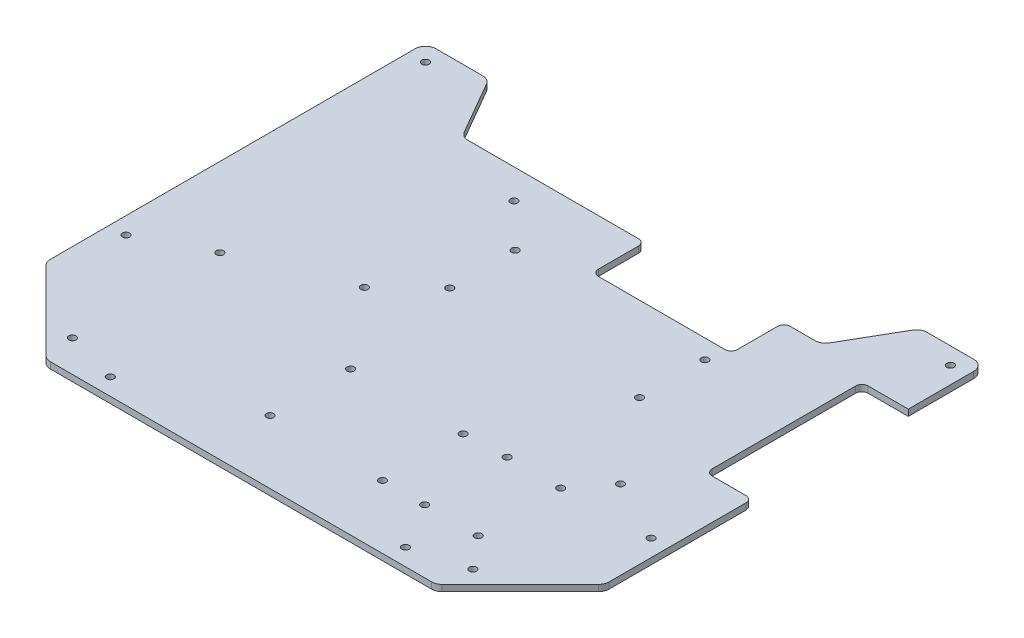
from build123d import *

# Parameters (mm, degrees)
BOSS_EXTRU_1_DEPTH           = 3
CONG_1_R                     = 5
ESQUISSE2_R                  = 1
ENL_V_MAT_EXTRU_1_DEPTH      = 3
D_GAGEMENT_M31_D             = 3.4
ESQUISSE5_W                  = 66
ESQUISSE5_H                  = 25
ESQUISSE5_W_2                = 22
ESQUISSE5_H_2                = 74
ENL_V_MAT_EXTRU_2_DEPTH      = 257.837010573
CONG_2_R                     = 3
ESQUISSE6_R                  = 1
ENL_V_MAT_EXTRU_3_DEPTH      = 257.837010573
D_GAGEMENT_M32_D             = 3.4
D_GAGEMENT_M32_DEPTH         = 10
D_GAGEMENT_M32_TIP           = 1.021463052
ESQUISSE9_R                  = 1
ENL_V_MAT_EXTRU_4_DEPTH      = 257.837010573
D_GAGEMENT_M33_D             = 3.4
D_GAGEMENT_M33_DEPTH         = 10
D_GAGEMENT_M33_TIP           = 1.021463052
ENL_V_MAT_EXTRU_5_DEPTH      = 257.837010573
ENL_V_MAT_EXTRU_5_DEPTH_BACK = 257.837010573
ESQUISSE12_R                 = 1
D_GAGEMENT_M34_D             = 3.4
D_GAGEMENT_M34_DEPTH         = 10
D_GAGEMENT_M34_TIP           = 1.021463052
D_GAGEMENT_M35_D             = 3.4
D_GAGEMENT_M35_DEPTH         = 10
D_GAGEMENT_M35_TIP           = 1.021463052


with BuildPart() as part:
    # Esquisse1 → Boss.-Extru.1 (new body)
    with BuildSketch(Plane(origin=(0, 0, 0), x_dir=(1, 0, 0), z_dir=(0, 1, 0))):
        Polygon((-92.5, 0), (92.5, 0), (132.5, 40), (132.5, 220), (102.5, 220), (85.179491924, 190), (-85.179491924, 190), (-102.5, 220), (-132.5, 220), (-132.5, 40), align=None)
    extrude(amount=BOSS_EXTRU_1_DEPTH)

    # Congé1
    cong_1_edges = [part.edges().sort_by_distance(p)[0] for p in [
        (92.5, 1.5, 0),
        (132.5, 1.5, -40),
        (132.5, 1.5, -220),
        (102.5, 1.5, -220),
        (85.179491924, 1.5, -190),
        (-85.179491924, 1.5, -190),
        (-102.5, 1.5, -220),
        (-132.5, 1.5, -220),
        (-92.5, 1.5, 0),
        (-132.5, 1.5, -40),
    ]]
    fillet(cong_1_edges, radius=CONG_1_R)

    # Esquisse2 → Enlèv. mat.-Extru.1 (cut)
    with BuildSketch(Plane(origin=(0, 3, 0), x_dir=(1, 0, 0), z_dir=(0, 1, 0))):
        with Locations((70, 8)):
            Circle(ESQUISSE2_R)
        with Locations((124.5, 70)):
            Circle(ESQUISSE2_R)
        with Locations((124.5, 212)):
            Circle(ESQUISSE2_R)
        with Locations((-124.5, 212)):
            Circle(ESQUISSE2_R)
        with Locations((-124.5, 70)):
            Circle(ESQUISSE2_R)
        with Locations((-70, 8)):
            Circle(ESQUISSE2_R)
    extrude(amount=-ENL_V_MAT_EXTRU_1_DEPTH, mode=Mode.SUBTRACT)

    # Dégagement M31 (through all)
    with Locations(Plane(origin=(0, 3, 0), x_dir=(1, 0, 0), z_dir=(0, 1, 0))):
        with Locations((70, 8), (-70, 8), (-124.5, 70), (-124.5, 212), (124.5, 212), (124.5, 70)):
            Hole(D_GAGEMENT_M31_D / 2)

    # Esquisse5 → Enlèv. mat.-Extru.2 (cut, through all)
    with BuildSketch(Plane(origin=(0, 3, 0), x_dir=(1, 0, 0), z_dir=(0, 1, 0))):
        with Locations((34.5, 177.5)):
            Rectangle(ESQUISSE5_W, ESQUISSE5_H)
        with Locations((121.5, 147)):
            Rectangle(ESQUISSE5_W_2, ESQUISSE5_H_2)
    extrude(amount=-ENL_V_MAT_EXTRU_2_DEPTH, mode=Mode.SUBTRACT)

    # Congé2
    cong_2_edges = [part.edges().sort_by_distance(p)[0] for p in [
        (132.5, 1.5, -110),
        (110.5, 1.5, -110),
        (110.5, 1.5, -184),
        (67.5, 1.5, -190),
        (67.5, 1.5, -165),
        (1.5, 1.5, -165),
        (1.5, 1.5, -190),
    ]]
    fillet(cong_2_edges, radius=CONG_2_R)

    # Esquisse6 → Enlèv. mat.-Extru.3 (cut, through all)
    with BuildSketch(Plane(origin=(0, 3, 0), x_dir=(1, 0, 0), z_dir=(0, 1, 0))):
        with Locations((64, 156)):
            Circle(ESQUISSE6_R)
        with Locations((-26, 156)):
            Circle(ESQUISSE6_R)
        with Locations((-46.5, 176)):
            Circle(ESQUISSE6_R)
        with Locations((64, 125)):
            Circle(ESQUISSE6_R)
        with Locations((-26, 125)):
            Circle(ESQUISSE6_R)
        with Locations((-46.5, 105)):
            Circle(ESQUISSE6_R)
    extrude(amount=-ENL_V_MAT_EXTRU_3_DEPTH, mode=Mode.SUBTRACT)

    # Dégagement M32
    with Locations(Plane(origin=(0, 3, 0), x_dir=(1, 0, 0), z_dir=(0, 1, 0))):
        with Locations((-46.5, 105), (-26, 125), (-26, 156), (-46.5, 176), (64, 156), (64, 125)):
            Hole(D_GAGEMENT_M32_D / 2, depth=D_GAGEMENT_M32_DEPTH)
            with Locations((0, 0, -(D_GAGEMENT_M32_DEPTH + D_GAGEMENT_M32_TIP / 2))):  # 118° drill point
                Cone(0, D_GAGEMENT_M32_D / 2, D_GAGEMENT_M32_TIP, mode=Mode.SUBTRACT)

    # Esquisse9 → Enlèv. mat.-Extru.4 (cut, through all)
    with BuildSketch(Plane(origin=(0, 3, 0), x_dir=(1, 0, 0), z_dir=(0, 1, 0))):
        with Locations((82.5, 30)):
            Circle(ESQUISSE9_R)
        with Locations((57.1, 30)):
            Circle(ESQUISSE9_R)
        with Locations((57.1, 69.12)):
            Circle(ESQUISSE9_R)
        with Locations((82.5, 69.12)):
            Circle(ESQUISSE9_R)
        with Locations((-16.24, 68.24)):
            Circle(ESQUISSE9_R)
        with Locations((37.1, 68.24)):
            Circle(ESQUISSE9_R)
        with Locations((37.1, 30)):
            Circle(ESQUISSE9_R)
        with Locations((-16.24, 30)):
            Circle(ESQUISSE9_R)
    extrude(amount=-ENL_V_MAT_EXTRU_4_DEPTH, mode=Mode.SUBTRACT)

    # Dégagement M33
    with Locations(Plane(origin=(0, 3, 0), x_dir=(1, 0, 0), z_dir=(0, 1, 0))):
        with Locations((57.1, 30), (82.5, 30), (57.1, 69.12), (82.5, 69.12)):
            Hole(D_GAGEMENT_M33_D / 2, depth=D_GAGEMENT_M33_DEPTH)
            with Locations((0, 0, -(D_GAGEMENT_M33_DEPTH + D_GAGEMENT_M33_TIP / 2))):  # 118° drill point
                Cone(0, D_GAGEMENT_M33_D / 2, D_GAGEMENT_M33_TIP, mode=Mode.SUBTRACT)

    # Esquisse12 → Enlèv. mat.-Extru.5 (cut, two sides: drawn at the far end of the back side and taken through both)
    with BuildSketch(Plane(origin=(0, 3, 0), x_dir=(1, 0, 0), z_dir=(0, 1, 0)).offset(-ENL_V_MAT_EXTRU_5_DEPTH_BACK)):
        with Locations((-95, 85)):
            Circle(ESQUISSE12_R)
        with Locations((95, 85)):
            Circle(ESQUISSE12_R)
        with Locations((95, 15)):
            Circle(ESQUISSE12_R)
        with Locations((-95, 15)):
            Circle(ESQUISSE12_R)
    extrude(amount=ENL_V_MAT_EXTRU_5_DEPTH + ENL_V_MAT_EXTRU_5_DEPTH_BACK, mode=Mode.SUBTRACT)

    # Dégagement M34
    with Locations(Plane(origin=(0, 3, 0), x_dir=(1, 0, 0), z_dir=(0, 1, 0))):
        with Locations((-16.24, 68.24), (-16.24, 30), (37.1, 30), (37.1, 68.24)):
            Hole(D_GAGEMENT_M34_D / 2, depth=D_GAGEMENT_M34_DEPTH)
            with Locations((0, 0, -(D_GAGEMENT_M34_DEPTH + D_GAGEMENT_M34_TIP / 2))):  # 118° drill point
                Cone(0, D_GAGEMENT_M34_D / 2, D_GAGEMENT_M34_TIP, mode=Mode.SUBTRACT)

    # Dégagement M35
    with Locations(Plane(origin=(0, 3, 0), x_dir=(1, 0, 0), z_dir=(0, 1, 0))):
        with Locations((-95, 15), (-95, 85), (95, 85), (95, 15)):
            Hole(D_GAGEMENT_M35_D / 2, depth=D_GAGEMENT_M35_DEPTH)
            with Locations((0, 0, -(D_GAGEMENT_M35_DEPTH + D_GAGEMENT_M35_TIP / 2))):  # 118° drill point
                Cone(0, D_GAGEMENT_M35_D / 2, D_GAGEMENT_M35_TIP, mode=Mode.SUBTRACT)


solid = part.part
